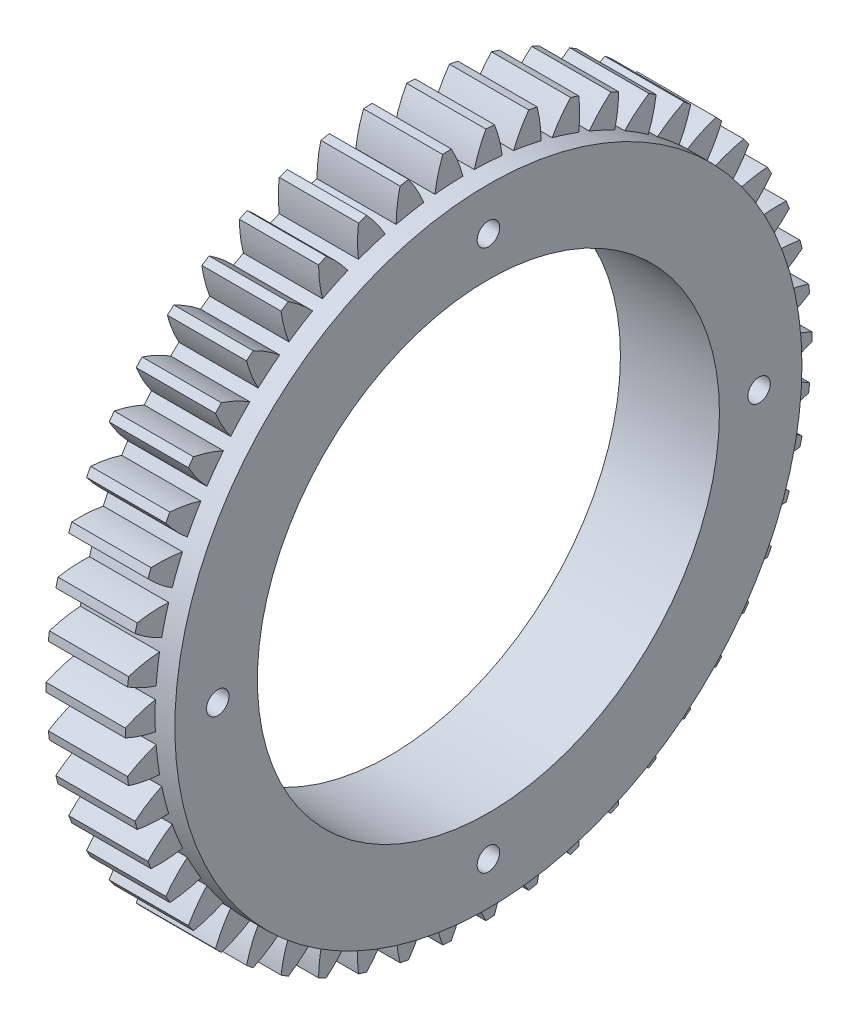
from build123d import *

# Parameters (mm, degrees)
BASPROSKE_W                  = 12
BASPROSKE_H                  = 52
TOOTHCUT_DEPTH               = 75.511744041
TEETHCUTS_COUNT              = 50
TEETHCUTS_ANGLE              = 352.8
BORSKE_R                     = 35
BORE_DEPTH                   = 50.0001524
SCHIZZO3_R                   = 47.499
SCHIZZO3_R_2                 = 35
ESTRUSIONE_ESTRUSIONE1_DEPTH = 3
FORO_PER_VITE_M3_1_D         = 3.4
FORO_PER_VITE_M3_1_DEPTH     = 188
FORO_PER_VITE_M3_1_TIP       = 1.021463052


with BuildPart() as part:
    # BasProSke → Base-Revolve (revolve)
    with BuildSketch(Plane(origin=(0, 0, 0), x_dir=(1, 0, 0), z_dir=(0, 1, 0))):
        with Locations((6, 26)):
            Rectangle(BASPROSKE_W, BASPROSKE_H)
    revolve(axis=Axis((-10, 0, 0), (1, 0, 0)))

    # TooCutSke → ToothCut (cut, through all)
    with BuildSketch(Plane(origin=(0, 0, 0), x_dir=(0, 0, -1), z_dir=(1, 0, 0))):
        with BuildLine():
            ThreePointArc((0.86062222, 47.491202663), (0, 47.499), (-0.86062222, 47.491202663))
            ThreePointArc((-0.86062222, 47.491202663), (-1.610166517, 49.778366785), (-2.629027787, 51.958930494))
            ThreePointArc((-2.629027787, 51.958930494), (0, 52.0254), (2.629027787, 51.958930494))
            ThreePointArc((2.629027787, 51.958930494), (1.610166517, 49.778366785), (0.86062222, 47.491202663))
        make_face()
    toothcut = extrude(amount=TOOTHCUT_DEPTH, mode=Mode.SUBTRACT)

    # TeethCuts: ToothCut ×50 about axis
    teethcuts_axis = Axis((-10, 0, 0), (1, 0, 0))
    for i in range(1, TEETHCUTS_COUNT):
        add(toothcut.rotate(teethcuts_axis, i * TEETHCUTS_ANGLE / (TEETHCUTS_COUNT - 1)), mode=Mode.SUBTRACT)

    # BorSke → Bore (cut, symmetric)
    with BuildSketch(Plane(origin=(0, 0, 0), x_dir=(0, 0, -1), z_dir=(1, 0, 0))):
        Circle(BORSKE_R)
    extrude(amount=BORE_DEPTH, both=True, mode=Mode.SUBTRACT)

    # Schizzo3 → Estrusione-Estrusione1 (add)
    with BuildSketch(Plane(origin=(12, 0, 0), x_dir=(0, 0, -1), z_dir=(1, 0, 0))):
        Circle(SCHIZZO3_R)
        Circle(SCHIZZO3_R_2, mode=Mode.SUBTRACT)
    extrude(amount=ESTRUSIONE_ESTRUSIONE1_DEPTH)

    # Foro per Vite M3-1
    with Locations(Plane(origin=(15, 0, 0), x_dir=(0, 0, -1), z_dir=(1, 0, 0))):
        with Locations((0, -41), (0, 41), (-41, 0), (41, 0)):
            Hole(FORO_PER_VITE_M3_1_D / 2, depth=FORO_PER_VITE_M3_1_DEPTH)
            with Locations((0, 0, -(FORO_PER_VITE_M3_1_DEPTH + FORO_PER_VITE_M3_1_TIP / 2))):  # 118° drill point
                Cone(0, FORO_PER_VITE_M3_1_D / 2, FORO_PER_VITE_M3_1_TIP, mode=Mode.SUBTRACT)


solid = part.part
